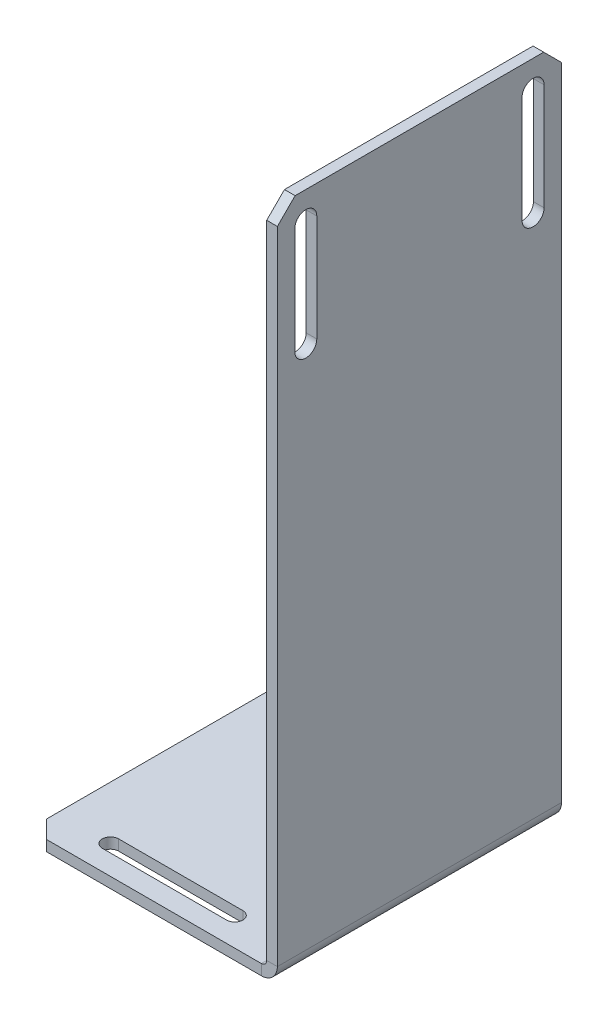
from build123d import *

# Parameters (mm, degrees)
SM_BASE_FLANGE_1_DEPTH = 40
CHAMFER_1_SIZE         = 5
CUT_EXTRUDE_1_DEPTH    = 206.399610516
CUT_EXTRUDE_2_DEPTH    = 204.639387153


# Sheet-metal steps are written as plain solids
with BuildPart() as part:
    # Sketch 2 → 基体-法兰1 (new, symmetric)
    with BuildSketch(Plane.XY):
        with BuildLine():
            Line((0, 190), (0, 4.5))
            ThreePointArc((0, 4.5), (-1.318019485, 1.318019485), (-4.5, 0))
            Line((-4.5, 0), (-70, 0))
            Line((-70, 0), (-70, 3))
            Line((-70, 3), (-4.5, 3))
            ThreePointArc((-4.5, 3), (-3.439339828, 3.439339828), (-3, 4.5))
            Line((-3, 4.5), (-3, 190))
            Line((-3, 190), (0, 190))
        make_face()
    extrude(amount=SM_BASE_FLANGE_1_DEPTH, both=True)

    # 倒角1
    chamfer_1_edges = [part.edges().sort_by_distance(p)[0] for p in [
        (-1.5, 190, 40),
        (-70, 1.5, 40),
        (-1.5, 190, -40),
        (-70, 1.5, -40),
    ]]
    chamfer(chamfer_1_edges, length=CHAMFER_1_SIZE)

    # 草图7 → 切除-拉伸1 (cut, through all)
    with BuildSketch(Plane.ZY.offset(3)):
        with BuildLine():
            Line((-28.9, 182), (-28.9, 152))
            ThreePointArc((-28.9, 152), (-32, 148.9), (-35.1, 152))
            Line((-35.1, 152), (-35.1, 182))
            ThreePointArc((-35.1, 182), (-32, 185.1), (-28.9, 182))
        make_face()
    cut_extrude_1 = extrude(amount=-CUT_EXTRUDE_1_DEPTH, mode=Mode.SUBTRACT)

    # 草图10 → 切除-拉伸2 (cut, through all)
    with BuildSketch(Plane(origin=(0, 3, 0), x_dir=(1, 0, 0), z_dir=(0, 1, 0))):
        with BuildLine():
            Line((-55, 34.3), (-20, 34.3))
            ThreePointArc((-20, 34.3), (-17.7, 32), (-20, 29.7))
            Line((-20, 29.7), (-55, 29.7))
            ThreePointArc((-55, 29.7), (-57.3, 32), (-55, 34.3))
        make_face()
    cut_extrude_2 = extrude(amount=-CUT_EXTRUDE_2_DEPTH, mode=Mode.SUBTRACT)

    # 镜向1: 切除-拉伸1, 切除-拉伸2 across plane
    add(cut_extrude_1.mirror(Plane.XY), mode=Mode.SUBTRACT)
    add(cut_extrude_2.mirror(Plane.XY), mode=Mode.SUBTRACT)


solid = part.part
